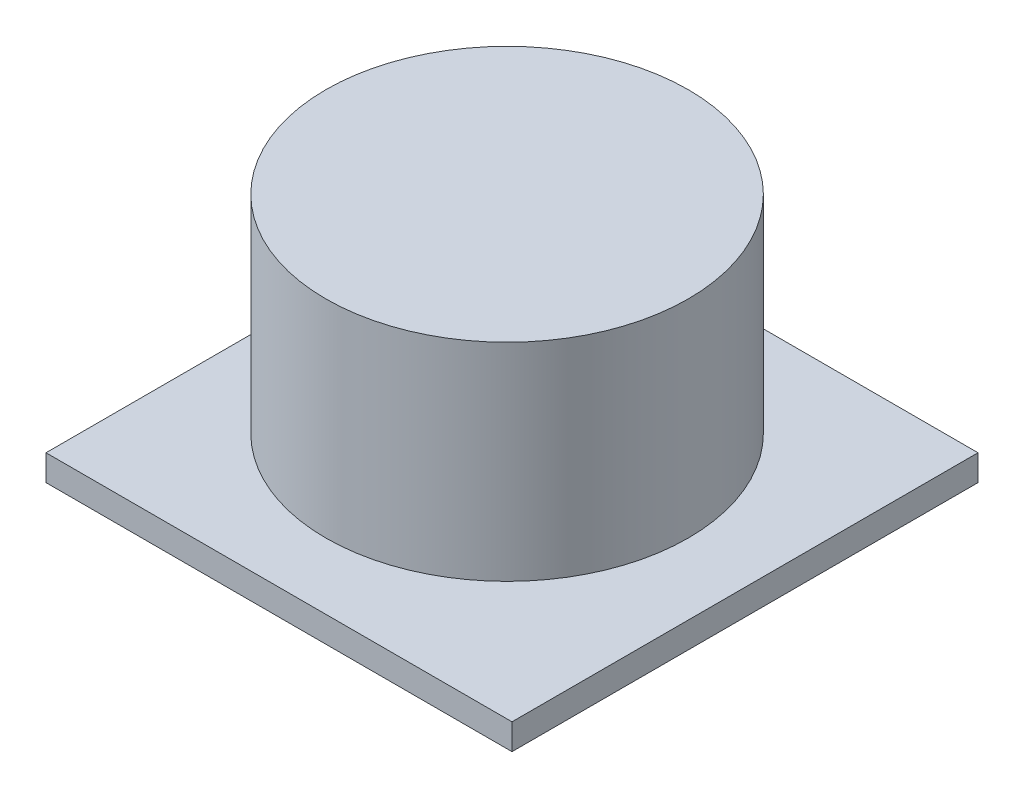
from build123d import *

# Parameters (mm, degrees)
SKETCH1_W           = 180
SKETCH1_H           = 180
BOSS_EXTRUDE1_DEPTH = 10
SKETCH2_R           = 70
BOSS_EXTRUDE2_DEPTH = 80


with BuildPart() as part:
    # Sketch1 → Boss-Extrude1 (new body)
    with BuildSketch(Plane(origin=(0, 0, 0), x_dir=(1, 0, 0), z_dir=(0, 1, 0))):
        with Locations((-49.591836735, -5.510204082)):
            Rectangle(SKETCH1_W, SKETCH1_H)
    extrude(amount=BOSS_EXTRUDE1_DEPTH)

    # Sketch2 → Boss-Extrude2 (add)
    with BuildSketch(Plane(origin=(0, 10, 0), x_dir=(1, 0, 0), z_dir=(0, 1, 0))):
        with Locations((-57.006666854, 0)):
            Circle(SKETCH2_R)
    extrude(amount=BOSS_EXTRUDE2_DEPTH)


solid = part.part
